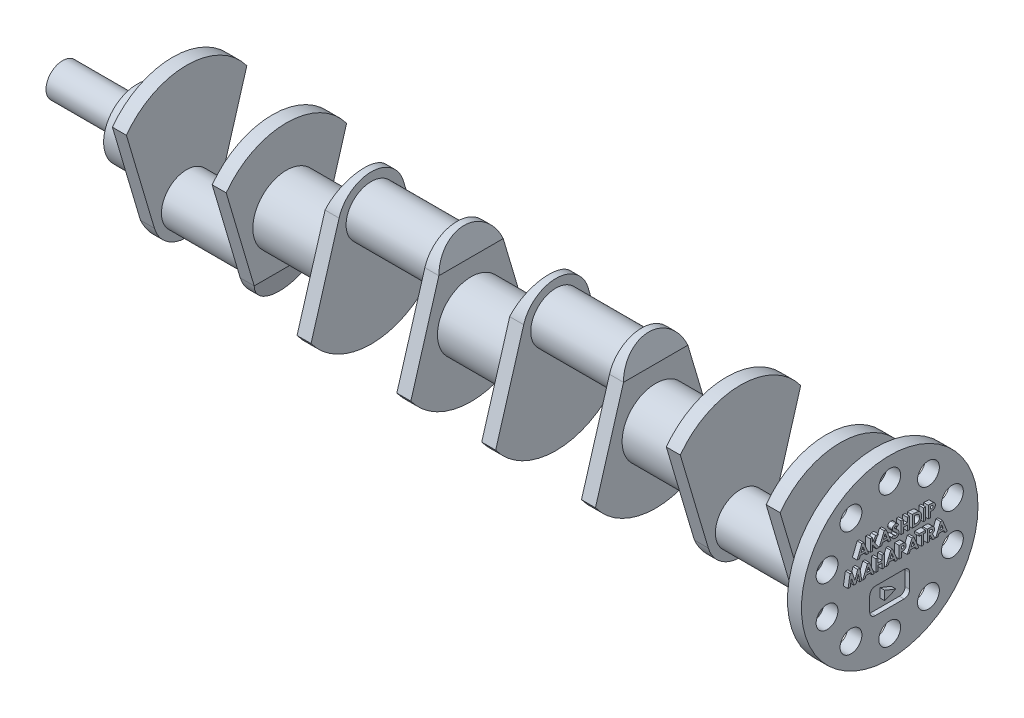
from build123d import *

# Parameters (mm, degrees)
SKETCH1_R               = 36
BOSS_EXTRUDE1_DEPTH     = 38
SKETCH3_R               = 27
BOSS_EXTRUDE2_DEPTH     = 15
SKETCH3_2_R             = 27
BOSS_EXTRUDE3_DEPTH     = 61
CUT_EXTRUDE1_DEPTH      = 143.724458813
CUT_EXTRUDE1_DEPTH_BACK = 143.724458813
BODY_MOVE_COPY1_ANGLE   = 180
SKETCH5_R               = 94.662126669
SKETCH5_R_2             = 11.708716401
BOSS_EXTRUDE4_DEPTH     = 15
SKETCH6_R               = 17.793512753
BOSS_EXTRUDE5_DEPTH     = 80
WRAP1_OUTLINE_W         = 2.279487179
WRAP1_OUTLINE_H         = 12.7
WRAP1_DEPTH             = 5
WRAP2_START             = -5
WRAP2_DEPTH             = 5


# Read off the part's stored shape, not the designer's step: Wrap1, Wrap2
with BuildPart() as part:
    # Sketch1 → Boss-Extrude1 (new body)
    with BuildSketch(Plane(origin=(0, 0, 0), x_dir=(0, 0, -1), z_dir=(1, 0, 0))):
        Circle(SKETCH1_R)
    extrude(amount=BOSS_EXTRUDE1_DEPTH)

    # Sketch3 → Boss-Extrude2 (add)
    with BuildSketch(Plane(origin=(38, 0, 0), x_dir=(0, 0, -1), z_dir=(1, 0, 0))):
        with BuildLine():
            Line((-34.517510455, -54.224552409), (-64.569893475, 47.23059238))
            ThreePointArc((-64.569893475, 47.23059238), (0, 80), (64.569893475, 47.23059238))
            Line((64.569893475, 47.23059238), (34.517510455, -54.224552409))
            ThreePointArc((34.517510455, -54.224552409), (0, -80), (-34.517510455, -54.224552409))
        make_face()
        with Locations(Location((0, -44, 0), (0, 0, 144.817798311))):
            Circle(SKETCH3_R, mode=Mode.SUBTRACT)
    extrude(amount=BOSS_EXTRUDE2_DEPTH)

    # Sketch3<2> → Boss-Extrude3 (add)
    with BuildSketch(Plane(origin=(38, 0, 0), x_dir=(0, 0, -1), z_dir=(1, 0, 0))):
        with Locations(Location((0, -44, 0), (0, 0, 180))):
            Circle(SKETCH3_2_R)
    extrude(amount=BOSS_EXTRUDE3_DEPTH)

    # Sketch4 → Cut-Extrude1 (cut, two sides: drawn at the far end of the back side and taken through both)
    with BuildSketch(Plane.XY.offset(-CUT_EXTRUDE1_DEPTH_BACK)):
        Polygon((38, -54.224552409), (45.5, -80), (38, -80), align=None)
    extrude(amount=CUT_EXTRUDE1_DEPTH + CUT_EXTRUDE1_DEPTH_BACK, mode=Mode.SUBTRACT)

    # Mirror1: part across plane


with BuildPart() as part_1:
    add(part.part)
    add(part.part.mirror(Plane(origin=(99, 0, 0), x_dir=(0, 0, 1), z_dir=(1, 0, 0))))


with BuildPart() as body_2:
    # Mirror2: mirrored copy
    add(part_1.part.mirror(Plane(origin=(198, 0, 0), x_dir=(0, 0, 1), z_dir=(1, 0, 0))))


with BuildPart() as body_2_1:
    # Body-Move/Copy1: moved
    add(body_2.part.rotate(Axis((0, 0, 0), (1, 0, 0)), BODY_MOVE_COPY1_ANGLE))

    # Combine1: union part
    add(part_1.part)

    # Mirror3: body 2 across plane


with BuildPart() as body_2_2:
    add(body_2_1.part)
    add(body_2_1.part.mirror(Plane(origin=(396, 0, 0), x_dir=(0, 0, 1), z_dir=(1, 0, 0))))

    # Sketch5 → Boss-Extrude4 (add)
    with BuildSketch(Plane(origin=(792, 0, 0), x_dir=(0, 0, -1), z_dir=(1, 0, 0))):
        Circle(SKETCH5_R)
        with Locations((0, 70.666718743)):
            Circle(SKETCH5_R_2, mode=Mode.SUBTRACT)
        with Locations((41.536855105, 57.1705764)):
            Circle(SKETCH5_R_2, mode=Mode.SUBTRACT)
        with Locations((67.208043346, 21.837217028)):
            Circle(SKETCH5_R_2, mode=Mode.SUBTRACT)
        with Locations((67.208043346, -21.837217028)):
            Circle(SKETCH5_R_2, mode=Mode.SUBTRACT)
        with Locations((41.536855105, -57.1705764)):
            Circle(SKETCH5_R_2, mode=Mode.SUBTRACT)
        with Locations((0, -70.666718743)):
            Circle(SKETCH5_R_2, mode=Mode.SUBTRACT)
        with Locations((-41.536855105, -57.1705764)):
            Circle(SKETCH5_R_2, mode=Mode.SUBTRACT)
        with Locations((-67.208043346, -21.837217028)):
            Circle(SKETCH5_R_2, mode=Mode.SUBTRACT)
        with Locations((-67.208043346, 21.837217028)):
            Circle(SKETCH5_R_2, mode=Mode.SUBTRACT)
        with Locations((-41.536855105, 57.1705764)):
            Circle(SKETCH5_R_2, mode=Mode.SUBTRACT)
    extrude(amount=BOSS_EXTRUDE4_DEPTH)

    # Sketch6 → Boss-Extrude5 (add)
    with BuildSketch(Plane.ZY):
        Circle(SKETCH6_R)
    extrude(amount=BOSS_EXTRUDE5_DEPTH)

    # Wrap1 outline → Wrap1 (add)
    # profile 1 of 17: a face of its own
    with BuildSketch(Plane(origin=(807, 0, 0), x_dir=(0, 0, -1), z_dir=(1, 0, 0))):
        with BuildLine():
            add(Edge.make_bspline(
                [(2.972212954, 29.383808048), (2.899198316, 29.486802786), (2.759020393, 29.68453832), (2.5318066, 29.94931086), (2.305618794, 30.175181541), (2.078361483, 30.361206779), (1.848020343, 30.506256333), (1.614995214, 30.60895302), (1.38060718, 30.674238278), (1.223134603, 30.682367863), (1.145570326, 30.686372151)],
                knots=[0, 0, 0, 0, 0.162420307, 0.31182434, 0.448432767, 0.573381197, 0.689077147, 0.797572901, 0.900293043, 1, 1, 1, 1], degree=3))
            Line((2.972212954, 29.383808048), (4.676740198, 30.943323272))
            add(Edge.make_bspline(
                [(1.171011031, 32.96585933), (1.320645634, 32.960385378), (1.618733676, 32.949480682), (2.059465444, 32.864209525), (2.489953807, 32.730111649), (2.836849399, 32.568337315), (3.112867746, 32.411626441), (3.324410025, 32.267346808), (3.539665681, 32.102066735), (3.760370616, 31.91526538), (3.982423792, 31.703423159), (4.212139242, 31.471583144), (4.446386812, 31.217741695), (4.598610591, 31.036398541), (4.676740198, 30.943323272)],
                knots=[0, 0, 0, 0, 0.10691022, 0.212976528, 0.319776676, 0.428556273, 0.485856803, 0.546558687, 0.611431498, 0.67982091, 0.753158505, 0.830752869, 0.913133075, 1, 1, 1, 1], degree=3))
            add(Edge.make_bspline(
                [(-2.161721341, 29.745066061), (-2.158966549, 29.853796648), (-2.153539314, 30.068007584), (-2.105127541, 30.382973554), (-2.032774301, 30.68688925), (-1.927696625, 30.97864585), (-1.791318489, 31.257877917), (-1.62569254, 31.525952409), (-1.428246921, 31.780402029), (-1.205739038, 32.021058095), (-0.960592319, 32.240990354), (-0.698621897, 32.435102608), (-0.421310546, 32.599052642), (-0.130354718, 32.735061099), (0.176048521, 32.839166933), (0.49564191, 32.912962337), (0.828883849, 32.95685349), (1.055547823, 32.962819983), (1.171011031, 32.96585933)],
                knots=[0, 0, 0, 0, 0.06317288, 0.12445736, 0.184840915, 0.244566821, 0.304319173, 0.365199786, 0.427420983, 0.491261689, 0.555499002, 0.618604518, 0.680494764, 0.742473305, 0.804990665, 0.868251971, 0.932887217, 1, 1, 1, 1], degree=3))
            add(Edge.make_bspline(
                [(1.038719364, 25.287854522), (0.877069822, 25.424625536), (0.566815423, 25.687130508), (0.128386595, 26.074842089), (-0.266677035, 26.437194087), (-0.614963275, 26.778665964), (-0.920909828, 27.092951528), (-1.182444692, 27.382603525), (-1.396694789, 27.649856224), (-1.622146817, 27.966399161), (-1.836371319, 28.352128481), (-2.021522081, 28.816205569), (-2.141640081, 29.280223772), (-2.155097632, 29.591740036), (-2.161721341, 29.745066061)],
                knots=[0, 0, 0, 0, 0.112124581, 0.215201009, 0.309902452, 0.395959096, 0.473447494, 0.542140328, 0.602523333, 0.654726333, 0.747804055, 0.835278417, 0.918925243, 1, 1, 1, 1], degree=3))
            add(Edge.make_bspline(
                [(2.722894044, 23.097409811), (2.718712332, 23.169878781), (2.710217585, 23.317092555), (2.647647893, 23.535975765), (2.54983238, 23.754759431), (2.434109731, 23.934211713), (2.316347444, 24.084462245), (2.203740137, 24.214647534), (2.066614226, 24.358479487), (1.9053174, 24.516139033), (1.721980813, 24.689014091), (1.516450026, 24.87708773), (1.286371495, 25.078703248), (1.123751536, 25.216041746), (1.038719364, 25.287854522)],
                knots=[0, 0, 0, 0, 0.076346606, 0.155090822, 0.238351561, 0.32840414, 0.37938386, 0.439617644, 0.509831416, 0.588874645, 0.677436354, 0.77554672, 0.882635872, 1, 1, 1, 1], degree=3))
            add(Edge.make_bspline(
                [(1.272773852, 21.894064458), (1.371612549, 21.898061749), (1.563374015, 21.905817076), (1.837088971, 21.97745069), (2.088041206, 22.089920719), (2.304962464, 22.250399941), (2.488637709, 22.435617354), (2.624200583, 22.641680195), (2.709362094, 22.864635214), (2.718365731, 23.019514437), (2.722894044, 23.097409811)],
                knots=[0, 0, 0, 0, 0.141985893, 0.275473311, 0.404345843, 0.535429711, 0.661427401, 0.77786684, 0.888279749, 1, 1, 1, 1], degree=3))
            add(Edge.make_bspline(
                [(-0.808275828, 23.522269586), (-0.734257286, 23.393607651), (-0.592357416, 23.146951724), (-0.351894821, 22.815538224), (-0.105553168, 22.531737421), (0.152362741, 22.300565511), (0.418716745, 22.118931429), (0.694795396, 21.989123113), (0.980792661, 21.908771912), (1.175601005, 21.898959175), (1.272773852, 21.894064458)],
                knots=[0, 0, 0, 0, 0.160457921, 0.307611547, 0.442138888, 0.566229194, 0.681222208, 0.789558005, 0.895028892, 1, 1, 1, 1], degree=3))
            Line((-0.808275828, 23.522269586), (-2.813003392, 22.318924234))
            add(Edge.make_bspline(
                [(1.188819525, 19.614577279), (1.080200932, 19.616504245), (0.865073826, 19.620320743), (0.548008996, 19.651479274), (0.241847059, 19.701765828), (-0.053067118, 19.773841481), (-0.338062178, 19.86517111), (-0.613149824, 19.976726752), (-0.876431035, 20.110237479), (-1.129897921, 20.262957779), (-1.372318321, 20.440286165), (-1.606757545, 20.638597215), (-1.83088692, 20.860941042), (-2.045782894, 21.106791812), (-2.250070503, 21.376845715), (-2.450436813, 21.66734175), (-2.637976943, 21.983671129), (-2.753828823, 22.205578748), (-2.813003392, 22.318924234)],
                knots=[0, 0, 0, 0, 0.063551482, 0.125868382, 0.18624025, 0.244976651, 0.303357688, 0.361230317, 0.418489049, 0.475936712, 0.534203744, 0.594059429, 0.655468694, 0.718771685, 0.784974607, 0.853522316, 0.925182451, 1, 1, 1, 1], degree=3))
            add(Edge.make_bspline(
                [(5.002381223, 23.229701478), (5.000107905, 23.101437205), (4.995647568, 22.84977793), (4.941017003, 22.481512066), (4.863117023, 22.129065652), (4.742669988, 21.796273802), (4.595869855, 21.477673839), (4.411834686, 21.178228539), (4.195710615, 20.894907392), (3.947999246, 20.63277511), (3.674001057, 20.394908233), (3.380111959, 20.183153521), (3.063458156, 20.008323033), (2.726745089, 19.864362597), (2.370152993, 19.753482345), (1.994106675, 19.671531504), (1.598030949, 19.622345901), (1.327188659, 19.61720413), (1.188819525, 19.614577279)],
                knots=[0, 0, 0, 0, 0.065200875, 0.127926544, 0.18904691, 0.248543693, 0.307607127, 0.36724766, 0.426963056, 0.488617128, 0.550391855, 0.611330734, 0.672556085, 0.734024191, 0.797340621, 0.862249627, 0.929625466, 1, 1, 1, 1], degree=3))
            add(Edge.make_bspline(
                [(3.689640839, 26.142662215), (3.801762188, 26.021322902), (4.017298797, 25.78806613), (4.297420407, 25.426591491), (4.527969553, 25.073718538), (4.706326744, 24.722807392), (4.841029268, 24.368795106), (4.935996332, 24.002999546), (4.992872739, 23.621598378), (4.999187348, 23.361338641), (5.002381223, 23.229701478)],
                knots=[0, 0, 0, 0, 0.150833097, 0.289954183, 0.417138648, 0.535255184, 0.648751095, 0.762405462, 0.879826701, 1, 1, 1, 1], degree=3))
            add(Edge.make_bspline(
                [(2.053803499, 27.60804683), (2.160634631, 27.515589874), (2.363377924, 27.340125781), (2.651841369, 27.091082672), (2.905352694, 26.86702466), (3.12760498, 26.671314375), (3.3152291, 26.501898369), (3.469013826, 26.357966835), (3.590837379, 26.242321856), (3.660086935, 26.172472218), (3.689640839, 26.142662215)],
                knots=[0, 0, 0, 0, 0.192952702, 0.366184141, 0.520457298, 0.655012135, 0.770624226, 0.865677185, 0.942674527, 1, 1, 1, 1], degree=3))
            add(Edge.make_bspline(
                [(0.328923691, 29.24642824), (0.358130834, 29.209555599), (0.42536182, 29.124679647), (0.55355754, 28.99024937), (0.714544441, 28.825560513), (0.914517638, 28.636276245), (1.145175693, 28.415589162), (1.417209906, 28.172174558), (1.722789945, 27.898494165), (1.939989157, 27.70791305), (2.053803499, 27.60804683)],
                knots=[0, 0, 0, 0, 0.059234189, 0.136349281, 0.233805212, 0.349411224, 0.48317915, 0.635966856, 0.809243356, 1, 1, 1, 1], degree=3))
            add(Edge.make_bspline(
                [(0.117765839, 29.854461093), (0.120009374, 29.80160011), (0.124527542, 29.695145435), (0.168166897, 29.539122852), (0.233943866, 29.386670625), (0.296796444, 29.293865701), (0.328923691, 29.24642824)],
                knots=[0, 0, 0, 0, 0.241881375, 0.487115475, 0.73783784, 1, 1, 1, 1], degree=3))
            add(Edge.make_bspline(
                [(1.145570326, 30.686372151), (1.073220594, 30.683834851), (0.933532269, 30.678935991), (0.7343962, 30.630241691), (0.557600361, 30.546202481), (0.403317298, 30.436314143), (0.28110235, 30.303924172), (0.183523191, 30.165081133), (0.128577926, 30.011829819), (0.121346047, 29.906570634), (0.117765839, 29.854461093)],
                knots=[0, 0, 0, 0, 0.148126258, 0.285992887, 0.416634394, 0.547379946, 0.671582838, 0.784400739, 0.893265576, 1, 1, 1, 1], degree=3))
        make_face()
    # profile 2 of 17: a face of its own
    with BuildSketch(Plane(origin=(807, 0, 0), x_dir=(0, 0, -1), z_dir=(1, 0, 0))):
        with BuildLine():
            add(Edge.make_bspline(
                [(22.040021448, 32.640218304), (22.263946809, 32.63865299), (22.696797065, 32.635627218), (23.323911453, 32.601534051), (23.907048032, 32.54910118), (24.446582703, 32.476970263), (24.941409334, 32.381521308), (25.390889855, 32.261799302), (25.79653283, 32.123600162), (26.162786052, 31.960980832), (26.497140015, 31.771382842), (26.814619775, 31.560185904), (27.114601966, 31.319653255), (27.401296365, 31.05442525), (27.671003119, 30.759649624), (27.928213812, 30.44020893), (28.166630759, 30.091470836), (28.393460789, 29.721796983), (28.598598368, 29.329620727), (28.777527029, 28.918280192), (28.927416654, 28.490422507), (29.049209736, 28.045591687), (29.146292878, 27.585264435), (29.214219996, 27.108511854), (29.256213218, 26.615775336), (29.260473079, 26.281823605), (29.262637634, 26.112133369)],
                knots=[0, 0, 0, 0, 0.060148162, 0.116267077, 0.168653955, 0.217398969, 0.262433523, 0.303932701, 0.342259967, 0.377441339, 0.411406099, 0.445398351, 0.479766387, 0.514584482, 0.550213651, 0.587000908, 0.624662987, 0.663615456, 0.703456428, 0.743450162, 0.784013386, 0.825132536, 0.867264663, 0.910306473, 0.954424205, 1, 1, 1, 1], degree=3))
            Line((22.040021448, 32.640218304), (19.167765839, 32.640218304))
            Line((19.167765839, 32.640218304), (19.167765839, 19.940218304))
            Line((19.167765839, 19.940218304), (22.083270647, 19.940218304))
            add(Edge.make_bspline(
                [(29.262637634, 26.112133369), (29.25696966, 25.872689399), (29.245811923, 25.401329929), (29.151825379, 24.709615338), (28.999817313, 24.046537912), (28.786080166, 23.417284499), (28.52110332, 22.827458695), (28.204558805, 22.287461829), (27.841087902, 21.800192332), (27.434925067, 21.368076407), (26.995149638, 20.996666912), (26.538134286, 20.678581859), (26.059426848, 20.427745253), (25.637618695, 20.268677335), (25.271858402, 20.169750852), (24.950724822, 20.111284348), (24.585949841, 20.057667037), (24.174132251, 20.016232733), (23.717078604, 19.979283516), (23.212967079, 19.95920675), (22.663429846, 19.942525937), (22.281724279, 19.941007671), (22.083270647, 19.940218304)],
                knots=[0, 0, 0, 0, 0.065772947, 0.129477895, 0.191430088, 0.252445668, 0.311786958, 0.36881755, 0.424091518, 0.478492106, 0.531393744, 0.58200397, 0.631201271, 0.679503008, 0.705561374, 0.735221723, 0.769132486, 0.80685832, 0.848929771, 0.895116661, 0.945469804, 1, 1, 1, 1], degree=3))
        make_face()
        with BuildLine():
            add(Edge.make_bspline(
                [(22.637878018, 22.219705484), (22.779544108, 22.219965075), (23.05201516, 22.220464355), (23.445401682, 22.244245481), (23.809184468, 22.268115174), (24.142362111, 22.31342065), (24.447359372, 22.363887762), (24.719986389, 22.434119658), (24.965863188, 22.507892316), (25.181986433, 22.601814053), (25.379937716, 22.707529219), (25.563217993, 22.831386791), (25.740134775, 22.968925954), (25.90738046, 23.12419193), (26.065588032, 23.295128705), (26.213821436, 23.482617042), (26.354059195, 23.686084908), (26.482701671, 23.906608087), (26.600255855, 24.141857806), (26.704539588, 24.389555327), (26.791006191, 24.651763438), (26.862871938, 24.926027555), (26.914228163, 25.214735459), (26.956715644, 25.51574873), (26.978619178, 25.830259957), (26.981625302, 26.044263908), (26.983150454, 26.152838497)],
                knots=[0, 0, 0, 0, 0.062614648, 0.120428813, 0.174199486, 0.223724664, 0.26902845, 0.310765001, 0.348115258, 0.382378114, 0.414753161, 0.447195432, 0.480044579, 0.513738641, 0.547962504, 0.582917814, 0.619315101, 0.657123545, 0.695686576, 0.735513716, 0.7758232, 0.817652262, 0.860742584, 0.905386927, 0.951998197, 1, 1, 1, 1], degree=3))
            Line((22.637878018, 22.219705484), (21.447253018, 22.219705484))
            Line((21.447253018, 22.219705484), (21.447253018, 30.360731125))
            Line((21.447253018, 30.360731125), (22.317325134, 30.360731125))
            add(Edge.make_bspline(
                [(25.784893243, 29.34310292), (25.690433567, 29.425777998), (25.497510374, 29.594632484), (25.158800647, 29.796963339), (24.785560069, 29.974730828), (24.369250015, 30.115680621), (23.913893938, 30.227149727), (23.416779727, 30.304027243), (22.880569537, 30.35342792), (22.509095611, 30.358244568), (22.317325134, 30.360731125)],
                knots=[0, 0, 0, 0, 0.101663476, 0.207636138, 0.318744567, 0.436679942, 0.563506646, 0.698681208, 0.844446556, 1, 1, 1, 1], degree=3))
            add(Edge.make_bspline(
                [(26.983150454, 26.152838497), (26.980112869, 26.31921879), (26.974189812, 26.643647471), (26.917069134, 27.116184925), (26.824087567, 27.561149728), (26.691411829, 27.976890495), (26.524169949, 28.364575677), (26.314827752, 28.720920758), (26.072394519, 29.051911845), (25.880684932, 29.246081838), (25.784893243, 29.34310292)],
                knots=[0, 0, 0, 0, 0.142276686, 0.277428514, 0.406477152, 0.530595072, 0.650142922, 0.766850697, 0.883502093, 1, 1, 1, 1], degree=3))
        make_face(mode=Mode.SUBTRACT)
    # profile 3 of 17: a face of its own
    with BuildSketch(Plane(origin=(807, 0, 0), x_dir=(0, 0, -1), z_dir=(1, 0, 0))):
        with BuildLine():
            add(Edge.make_bspline(
                [(38.970810711, 32.640218304), (39.137036978, 32.63947424), (39.45772229, 32.638038785), (39.920176894, 32.620631975), (40.346813909, 32.589437911), (40.737535316, 32.550886981), (41.09218046, 32.496840078), (41.411193464, 32.434879535), (41.694640529, 32.359393561), (41.945717944, 32.269792755), (42.171051813, 32.164156906), (42.384290331, 32.051647186), (42.580614282, 31.917370804), (42.76993273, 31.775799497), (42.941422013, 31.613409014), (43.105780658, 31.441006676), (43.256047629, 31.251755148), (43.392919207, 31.04794527), (43.517082819, 30.833342576), (43.625560457, 30.60756342), (43.713551442, 30.370250531), (43.787364937, 30.122939053), (43.846652655, 29.865639764), (43.886116448, 29.596770251), (43.912922241, 29.318207863), (43.915287482, 29.128618126), (43.916483788, 29.032726317)],
                knots=[0, 0, 0, 0, 0.070781161, 0.136551696, 0.197012482, 0.252922694, 0.303686532, 0.349719151, 0.391240471, 0.428478555, 0.463056565, 0.497150358, 0.531002334, 0.564226377, 0.59770067, 0.631421421, 0.665597347, 0.700451436, 0.735880684, 0.771092108, 0.806974845, 0.843534403, 0.880940196, 0.919294384, 0.95918024, 1, 1, 1, 1], degree=3))
            Line((38.970810711, 32.640218304), (36.426740198, 32.640218304))
            Line((36.426740198, 32.640218304), (36.426740198, 19.940218304))
            Line((36.426740198, 19.940218304), (38.706227377, 19.940218304))
            Line((38.706227377, 19.940218304), (38.706227377, 25.47611574))
            add(Edge.make_bspline(
                [(41.293547089, 25.669465099), (41.228442459, 25.653266962), (41.087404865, 25.61817658), (40.854026385, 25.582551036), (40.585082191, 25.549795538), (40.279702609, 25.521646153), (39.937711582, 25.50251113), (39.559440246, 25.487567528), (39.144717174, 25.476701987), (38.85633515, 25.476316429), (38.706227377, 25.47611574)],
                knots=[0, 0, 0, 0, 0.077372749, 0.167614291, 0.272108317, 0.390015992, 0.52136331, 0.667272254, 0.826809521, 1, 1, 1, 1], degree=3))
            add(Edge.make_bspline(
                [(43.916483788, 29.032726317), (43.914752883, 28.926643492), (43.911351444, 28.718177704), (43.878006373, 28.412592436), (43.821042458, 28.121244549), (43.7465936, 27.841677056), (43.642779962, 27.578489461), (43.524177756, 27.325402028), (43.378259423, 27.089510551), (43.2115244, 26.867864312), (43.029430733, 26.658661223), (42.827655527, 26.467941627), (42.610044702, 26.294405395), (42.377857932, 26.136233854), (42.130223516, 25.993746072), (41.867320135, 25.865607801), (41.587352535, 25.7559173), (41.392391523, 25.698550057), (41.293547089, 25.669465099)],
                knots=[0, 0, 0, 0, 0.068875425, 0.135348675, 0.199289315, 0.26155008, 0.322915384, 0.382771997, 0.442843572, 0.502652029, 0.562748843, 0.622739582, 0.682687332, 0.743329247, 0.805012514, 0.86806712, 0.933110571, 1, 1, 1, 1], degree=3))
        make_face()
        with BuildLine():
            add(Edge.make_bspline(
                [(39.51269773, 27.75560292), (39.659447743, 27.756533429), (39.929469947, 27.758245579), (40.298224924, 27.783004269), (40.594563517, 27.820815788), (40.828676508, 27.875046252), (41.013530889, 27.957348162), (41.17295622, 28.052555973), (41.309699396, 28.172943636), (41.428098859, 28.310507141), (41.522755663, 28.468574502), (41.588395225, 28.644571901), (41.631033395, 28.834801442), (41.634971426, 28.967188612), (41.636996608, 29.035270388)],
                knots=[0, 0, 0, 0, 0.155159592, 0.285495954, 0.390502806, 0.470975045, 0.538445527, 0.60365534, 0.666587169, 0.73019895, 0.794944675, 0.860228437, 0.928120706, 1, 1, 1, 1], degree=3))
            Line((39.51269773, 27.75560292), (38.706227377, 27.75560292))
            Line((38.706227377, 27.75560292), (38.706227377, 30.360731125))
            Line((38.706227377, 30.360731125), (39.423655262, 30.360731125))
            add(Edge.make_bspline(
                [(41.039140038, 30.108868144), (40.99882373, 30.129257257), (40.913465844, 30.172425187), (40.76809309, 30.222611063), (40.600335152, 30.264948377), (40.409059474, 30.300087939), (40.19502911, 30.327359888), (39.958282247, 30.348216107), (39.69847049, 30.356603205), (39.517786958, 30.3593172), (39.423655262, 30.360731125)],
                knots=[0, 0, 0, 0, 0.08210116, 0.173824981, 0.278953094, 0.396639095, 0.527315592, 0.671298143, 0.82875438, 1, 1, 1, 1], degree=3))
            add(Edge.make_bspline(
                [(41.636996608, 29.035270388), (41.634992258, 29.094752549), (41.631103336, 29.210162243), (41.602534257, 29.376727058), (41.557003365, 29.531999826), (41.491030851, 29.674358929), (41.405744013, 29.803562476), (41.301762098, 29.919559569), (41.180419399, 30.024834384), (41.08673574, 30.080557952), (41.039140038, 30.108868144)],
                knots=[0, 0, 0, 0, 0.137787685, 0.267341238, 0.390444331, 0.511777883, 0.629508981, 0.747829066, 0.87188531, 1, 1, 1, 1], degree=3))
        make_face(mode=Mode.SUBTRACT)
    # profile 4 of 17: a face of its own
    with BuildSketch(Plane(origin=(807, 0, 0), x_dir=(0, 0, -1), z_dir=(1, 0, 0))):
        with BuildLine():
            add(Edge.make_bspline(
                [(7.709272249, 10.962013176), (7.875498516, 10.961269112), (8.196183828, 10.959833656), (8.658638432, 10.942426846), (9.085275447, 10.911232783), (9.475996854, 10.872681853), (9.830641999, 10.81863495), (10.149655002, 10.756674407), (10.433102068, 10.681188432), (10.684179482, 10.591587627), (10.909513352, 10.485951778), (11.122751869, 10.373442058), (11.31907582, 10.239165676), (11.508394268, 10.097594369), (11.679883551, 9.935203886), (11.844242196, 9.762801548), (11.994509168, 9.57355002), (12.131380746, 9.369740141), (12.255544358, 9.155137447), (12.364021995, 8.929358292), (12.45201298, 8.692045402), (12.525826475, 8.444733924), (12.585114193, 8.187434636), (12.624577986, 7.918565123), (12.651383779, 7.640002735), (12.65374902, 7.450412998), (12.654945326, 7.354521189)],
                knots=[0, 0, 0, 0, 0.070781161, 0.136551696, 0.197012482, 0.252922694, 0.303686532, 0.349719151, 0.391240471, 0.428478555, 0.463056565, 0.497150358, 0.531002334, 0.564226377, 0.59770067, 0.631421421, 0.665597347, 0.700451436, 0.735880684, 0.771092108, 0.806974845, 0.843534403, 0.880940196, 0.919294384, 0.95918024, 1, 1, 1, 1], degree=3))
            Line((7.709272249, 10.962013176), (5.165201736, 10.962013176))
            Line((5.165201736, 10.962013176), (5.165201736, -1.737986824))
            Line((5.165201736, -1.737986824), (7.444688916, -1.737986824))
            Line((7.444688916, -1.737986824), (7.444688916, 3.797910612))
            add(Edge.make_bspline(
                [(10.032008627, 3.991259971), (9.966903997, 3.975061834), (9.825866403, 3.939971452), (9.592487924, 3.904345907), (9.323543729, 3.871590409), (9.018164148, 3.843441024), (8.676173121, 3.824306002), (8.297901784, 3.8093624), (7.883178713, 3.798496858), (7.594796689, 3.798111301), (7.444688916, 3.797910612)],
                knots=[0, 0, 0, 0, 0.077372749, 0.167614291, 0.272108317, 0.390015992, 0.52136331, 0.667272254, 0.826809521, 1, 1, 1, 1], degree=3))
            add(Edge.make_bspline(
                [(12.654945326, 7.354521189), (12.653214422, 7.248438364), (12.649812982, 7.039972576), (12.616467912, 6.734387307), (12.559503996, 6.443039421), (12.485055138, 6.163471928), (12.381241501, 5.900284333), (12.262639294, 5.6471969), (12.116720961, 5.411305423), (11.949985939, 5.189659184), (11.767892272, 4.980456095), (11.566117065, 4.789736499), (11.348506241, 4.616200267), (11.11631947, 4.458028726), (10.868685054, 4.315540944), (10.605781673, 4.187402672), (10.325814074, 4.077712172), (10.130853061, 4.020344928), (10.032008627, 3.991259971)],
                knots=[0, 0, 0, 0, 0.068875425, 0.135348675, 0.199289315, 0.26155008, 0.322915384, 0.382771997, 0.442843572, 0.502652029, 0.562748843, 0.622739582, 0.682687332, 0.743329247, 0.805012514, 0.86806712, 0.933110571, 1, 1, 1, 1], degree=3))
        make_face()
        with BuildLine():
            add(Edge.make_bspline(
                [(8.251159268, 6.077397792), (8.397909281, 6.078328301), (8.667931485, 6.080040451), (9.036686462, 6.10479914), (9.333025055, 6.14261066), (9.567138047, 6.196841124), (9.751992428, 6.279143033), (9.911417758, 6.374350844), (10.048160934, 6.494738508), (10.166560398, 6.632302013), (10.261217201, 6.790369374), (10.326856764, 6.966366772), (10.369494933, 7.156596314), (10.373432964, 7.288983483), (10.375458147, 7.35706526)],
                knots=[0, 0, 0, 0, 0.155159592, 0.285495954, 0.390502806, 0.470975045, 0.538445527, 0.60365534, 0.666587169, 0.73019895, 0.794944675, 0.860228437, 0.928120706, 1, 1, 1, 1], degree=3))
            Line((8.251159268, 6.077397792), (7.444688916, 6.077397792))
            Line((7.444688916, 6.077397792), (7.444688916, 8.682525997))
            Line((7.444688916, 8.682525997), (8.1621168, 8.682525997))
            add(Edge.make_bspline(
                [(9.777601576, 8.430663016), (9.737285268, 8.451052129), (9.651927383, 8.494220059), (9.506554629, 8.544405934), (9.33879669, 8.586743249), (9.147521012, 8.621882811), (8.933490649, 8.64915476), (8.696743786, 8.670010979), (8.436932028, 8.678398077), (8.256248497, 8.681112072), (8.1621168, 8.682525997)],
                knots=[0, 0, 0, 0, 0.08210116, 0.173824981, 0.278953094, 0.396639095, 0.527315592, 0.671298143, 0.82875438, 1, 1, 1, 1], degree=3))
            add(Edge.make_bspline(
                [(10.375458147, 7.35706526), (10.373453796, 7.416547421), (10.369564874, 7.531957115), (10.340995796, 7.698521929), (10.295464903, 7.853794698), (10.22949239, 7.9961538), (10.144205552, 8.125357347), (10.040223637, 8.241354441), (9.918880937, 8.346629256), (9.825197279, 8.402352824), (9.777601576, 8.430663016)],
                knots=[0, 0, 0, 0, 0.137787685, 0.267341238, 0.390444331, 0.511777883, 0.629508981, 0.747829066, 0.87188531, 1, 1, 1, 1], degree=3))
        make_face(mode=Mode.SUBTRACT)
    # profile 5 of 17: a face of its own
    with BuildSketch(Plane(origin=(807, 0, 0), x_dir=(0, 0, -1), z_dir=(1, 0, 0))):
        with BuildLine():
            add(Edge.make_bspline(
                [(37.943006223, 10.962013176), (38.118567651, 10.961390034), (38.456221728, 10.960191556), (38.943100465, 10.941282745), (39.390365542, 10.914969582), (39.798679175, 10.874814997), (40.167866681, 10.821574871), (40.498298071, 10.758813573), (40.789963689, 10.687283618), (41.045323329, 10.598151651), (41.275772778, 10.497612143), (41.490583703, 10.382090405), (41.694495152, 10.252872808), (41.886144198, 10.106559287), (42.067196316, 9.945781986), (42.237993071, 9.770379067), (42.396120948, 9.578863186), (42.540600812, 9.37244448), (42.672282578, 9.155296735), (42.788661641, 8.927121805), (42.883301288, 8.687761011), (42.966925562, 8.440673632), (43.027157417, 8.182327507), (43.069047791, 7.915237678), (43.099718284, 7.638463961), (43.101481691, 7.450436187), (43.102381223, 7.354521189)],
                knots=[0, 0, 0, 0, 0.072889027, 0.14018613, 0.202277434, 0.258895132, 0.310482942, 0.357095244, 0.398513567, 0.435037511, 0.469251486, 0.502805028, 0.536210446, 0.56937936, 0.602801475, 0.636665798, 0.670928657, 0.705803, 0.741189061, 0.776304311, 0.812004301, 0.847968976, 0.884521761, 0.921974159, 0.960198176, 1, 1, 1, 1], degree=3))
            Line((37.943006223, 10.962013176), (35.286996608, 10.962013176))
            Line((35.286996608, 10.962013176), (35.286996608, -1.737986824))
            Line((35.286996608, -1.737986824), (37.566483788, -1.737986824))
            Line((37.566483788, -1.737986824), (37.566483788, 3.797910612))
            Line((37.566483788, 3.797910612), (38.339881223, 3.797910612))
            Line((38.339881223, 3.797910612), (41.138358788, -1.737986824))
            Line((41.138358788, -1.737986824), (43.672253018, -1.737986824))
            Line((43.672253018, -1.737986824), (40.741483788, 4.057405804))
            add(Edge.make_bspline(
                [(43.102381223, 7.354521189), (43.100044561, 7.254407965), (43.095462791, 7.058104179), (43.070782886, 6.769749928), (43.025675773, 6.493872751), (42.957354488, 6.23128038), (42.878828045, 5.97870455), (42.774408019, 5.74080544), (42.6565597, 5.514123155), (42.516594694, 5.301864199), (42.362989937, 5.099313879), (42.184350837, 4.914232647), (41.992250461, 4.73667309), (41.77589015, 4.577756934), (41.544807267, 4.426738844), (41.294410437, 4.289876237), (41.026333836, 4.163728702), (40.837862709, 4.093380122), (40.741483788, 4.057405804)],
                knots=[0, 0, 0, 0, 0.068741263, 0.134789088, 0.19853605, 0.260385651, 0.320961578, 0.37990385, 0.438502936, 0.496154344, 0.554265483, 0.612748761, 0.672513443, 0.733646402, 0.796789619, 0.861935699, 0.929397735, 1, 1, 1, 1], degree=3))
        make_face()
        with BuildLine():
            add(Edge.make_bspline(
                [(38.454364397, 6.077397792), (38.562915181, 6.078620364), (38.77076661, 6.080961326), (39.069684264, 6.09181968), (39.341172781, 6.117982949), (39.586398026, 6.151039261), (39.80659395, 6.189207547), (39.999796481, 6.243905018), (40.168982577, 6.302514743), (40.312147377, 6.375351427), (40.434464092, 6.458182535), (40.540076746, 6.552280733), (40.627433554, 6.661187415), (40.699332663, 6.781942968), (40.755262353, 6.915615444), (40.796086742, 7.060737423), (40.818901538, 7.218962031), (40.821526458, 7.328158555), (40.822894044, 7.385050035)],
                knots=[0, 0, 0, 0, 0.105539996, 0.202086415, 0.290684899, 0.37055261, 0.442670262, 0.507674928, 0.565573203, 0.616454666, 0.663331357, 0.708862024, 0.7534118, 0.798515011, 0.845064321, 0.893873119, 0.944707806, 1, 1, 1, 1], degree=3))
            Line((38.454364397, 6.077397792), (37.566483788, 6.077397792))
            Line((37.566483788, 6.077397792), (37.566483788, 8.682525997))
            Line((37.566483788, 8.682525997), (38.342425294, 8.682525997))
            add(Edge.make_bspline(
                [(40.822894044, 7.385050035), (40.820308498, 7.45235681), (40.815229673, 7.584568496), (40.764831945, 7.774906965), (40.68460965, 7.951078241), (40.574646855, 8.112286338), (40.436163011, 8.253612484), (40.277241873, 8.378192608), (40.094453541, 8.476701248), (39.925205301, 8.541676498), (39.771228962, 8.58055186), (39.632270175, 8.609521437), (39.471355062, 8.630053007), (39.288362142, 8.651830392), (39.083757871, 8.665951924), (38.856427031, 8.676257827), (38.607022517, 8.680474478), (38.433163882, 8.681822468), (38.342425294, 8.682525997)],
                knots=[0, 0, 0, 0, 0.06376896, 0.125262305, 0.185413583, 0.246806762, 0.309422389, 0.372532682, 0.437733251, 0.505749517, 0.544013263, 0.588369599, 0.640389019, 0.697897401, 0.763271619, 0.834978604, 0.913873656, 1, 1, 1, 1], degree=3))
        make_face(mode=Mode.SUBTRACT)
    # profile 6 of 17: a face of its own
    with BuildSketch(Plane(origin=(807, 0, 0), x_dir=(0, 0, -1), z_dir=(1, 0, 0))):
        Polygon((-27.643131597, 19.940218304), (-32.771977751, 32.640218304), (-34.886100347, 32.640218304), (-40.017490571, 19.940218304), (-37.585359161, 19.940218304), (-36.598259802, 22.54534651), (-31.064906437, 22.54534651), (-30.077807078, 19.940218304), align=None)
        Polygon((-31.927346341, 24.824833689), (-35.733275828, 24.824833689), (-33.830311084, 29.233707888), align=None, mode=Mode.SUBTRACT)
    # profile 7 of 17: a face of its own
    with BuildSketch(Plane(origin=(807, 0, 0), x_dir=(0, 0, -1), z_dir=(1, 0, 0))):
        Polygon((-19.316388809, 19.940218304), (-16.571336725, 19.940218304), (-21.537362366, 27.022910612), (-17.011460924, 32.640218304), (-19.888804674, 32.640218304), (-23.49120852, 28.170286413), (-23.49120852, 32.640218304), (-25.7706957, 32.640218304), (-25.7706957, 19.940218304), (-23.49120852, 19.940218304), (-23.49120852, 25.895887375), align=None)
    # profile 8 of 17: a face of its own
    with BuildSketch(Plane(origin=(807, 0, 0), x_dir=(0, 0, -1), z_dir=(1, 0, 0))):
        Polygon((-6.143191693, 19.940218304), (-3.708516212, 19.940218304), (-8.837362366, 32.640218304), (-10.951484962, 32.640218304), (-16.082875187, 19.940218304), (-13.650743777, 19.940218304), (-12.663644418, 22.54534651), (-7.130291052, 22.54534651), align=None)
        Polygon((-7.992730956, 24.824833689), (-11.798660443, 24.824833689), (-9.8956957, 29.233707888), align=None, mode=Mode.SUBTRACT)
    # profile 9 of 17: a face of its own
    with BuildSketch(Plane(origin=(807, 0, 0), x_dir=(0, 0, -1), z_dir=(1, 0, 0))):
        Polygon((13.957509429, 19.940218304), (16.236996608, 19.940218304), (16.236996608, 32.640218304), (13.957509429, 32.640218304), (13.957509429, 27.75560292), (9.561355582, 27.75560292), (9.561355582, 32.640218304), (7.281868403, 32.640218304), (7.281868403, 19.940218304), (9.561355582, 19.940218304), (9.561355582, 25.47611574), (13.957509429, 25.47611574), align=None)
    # profile 10 of 17: a face of its own
    with BuildSketch(Plane(origin=(807, 0, 0), x_dir=(0, 0, -1), z_dir=(1, 0, 0))):
        with Locations((32.356227378, 26.290218304)):
            Rectangle(WRAP1_OUTLINE_W, WRAP1_OUTLINE_H)
    # profile 11 of 17: a face of its own
    with BuildSketch(Plane(origin=(807, 0, 0), x_dir=(0, 0, -1), z_dir=(1, 0, 0))):
        Polygon((33.495970967, 8.682525997), (33.495970967, 10.962013176), (26.657509429, 10.962013176), (26.657509429, 8.682525997), (28.936996608, 8.682525997), (28.936996608, -1.737986824), (31.216483788, -1.737986824), (31.216483788, 8.682525997), align=None)
    # profile 12 of 17: a face of its own
    with BuildSketch(Plane(origin=(807, 0, 0), x_dir=(0, 0, -1), z_dir=(1, 0, 0))):
        Polygon((-42.296977751, 2.103559651), (-45.194674065, 10.962013176), (-47.560659642, 10.962013176), (-49.705311084, -1.737986824), (-47.395295059, -1.737986824), (-46.041849546, 6.283467503), (-43.416368777, -1.737986824), (-41.192851148, -1.737986824), (-38.552105956, 6.283467503), (-37.196116373, -1.737986824), (-34.888644418, -1.737986824), (-37.03583993, 10.962013176), (-39.378928873, 10.962013176), align=None)
    # profile 13 of 17: a face of its own
    with BuildSketch(Plane(origin=(807, 0, 0), x_dir=(0, 0, -1), z_dir=(1, 0, 0))):
        Polygon((-26.747618777, 10.962013176), (-28.861741373, 10.962013176), (-33.993131597, -1.737986824), (-31.561000187, -1.737986824), (-30.573900828, 0.867141381), (-25.040547462, 0.867141381), (-24.053448103, -1.737986824), (-21.618772623, -1.737986824), align=None)
        Polygon((-25.902987366, 3.146628561), (-29.708916853, 3.146628561), (-27.80595211, 7.55550276), align=None, mode=Mode.SUBTRACT)
    # profile 14 of 17: a face of its own
    with BuildSketch(Plane(origin=(807, 0, 0), x_dir=(0, 0, -1), z_dir=(1, 0, 0))):
        Polygon((-10.79120852, 10.962013176), (-13.0706957, 10.962013176), (-13.0706957, 6.077397792), (-17.466849546, 6.077397792), (-17.466849546, 10.962013176), (-19.746336725, 10.962013176), (-19.746336725, -1.737986824), (-17.466849546, -1.737986824), (-17.466849546, 3.797910612), (-13.0706957, 3.797910612), (-13.0706957, -1.737986824), (-10.79120852, -1.737986824), align=None)
    # profile 15 of 17: a face of its own
    with BuildSketch(Plane(origin=(807, 0, 0), x_dir=(0, 0, -1), z_dir=(1, 0, 0))):
        Polygon((-1.836080315, 10.962013176), (-3.950202911, 10.962013176), (-9.081593136, -1.737986824), (-6.649461725, -1.737986824), (-5.662362366, 0.867141381), (-0.129009001, 0.867141381), (0.858090358, -1.737986824), (3.292765839, -1.737986824), align=None)
        Polygon((-0.991448905, 3.146628561), (-4.797378392, 3.146628561), (-2.894413648, 7.55550276), align=None, mode=Mode.SUBTRACT)
    # profile 16 of 17: a face of its own
    with BuildSketch(Plane(origin=(807, 0, 0), x_dir=(0, 0, -1), z_dir=(1, 0, 0))):
        Polygon((20.95879148, 10.962013176), (18.844668884, 10.962013176), (13.713278659, -1.737986824), (16.14541007, -1.737986824), (17.132509429, 0.867141381), (22.665862794, 0.867141381), (23.652962153, -1.737986824), (26.087637634, -1.737986824), align=None)
        Polygon((21.80342289, 3.146628561), (17.997493403, 3.146628561), (19.900458147, 7.55550276), align=None, mode=Mode.SUBTRACT)
    # profile 17 of 17: a face of its own
    with BuildSketch(Plane(origin=(807, 0, 0), x_dir=(0, 0, -1), z_dir=(1, 0, 0))):
        Polygon((51.56904789, 10.962013176), (49.454925294, 10.962013176), (44.32353507, -1.737986824), (46.75566648, -1.737986824), (47.742765839, 0.867141381), (53.276119204, 0.867141381), (54.263218563, -1.737986824), (56.697894044, -1.737986824), align=None)
        Polygon((52.4136793, 3.146628561), (48.607749813, 3.146628561), (50.510714557, 7.55550276), align=None, mode=Mode.SUBTRACT)
    extrude(amount=WRAP1_DEPTH)

    # Wrap2 outline → Wrap2 (cut)
    with BuildSketch(Plane(origin=(807, 0, 0), x_dir=(0, 0, -1), z_dir=(1, 0, 0)).offset(WRAP2_START)):
        with BuildLine():
            Line((-15.429839426, -46.396758526), (15.429839426, -46.396758526))
            ThreePointArc((15.429839426, -46.396758526), (19.672480113, -44.639399213), (21.429839426, -40.396758526))
            Line((21.429839426, -40.396758526), (21.429839426, -24.982502654))
            ThreePointArc((21.429839426, -24.982502654), (19.672480113, -20.739861967), (15.429839426, -18.982502654))
            Line((15.429839426, -18.982502654), (-15.429839426, -18.982502654))
            ThreePointArc((-15.429839426, -18.982502654), (-19.672480113, -20.739861967), (-21.429839426, -24.982502654))
            Line((-21.429839426, -24.982502654), (-21.429839426, -40.396758526))
            ThreePointArc((-21.429839426, -40.396758526), (-19.672480113, -44.639399213), (-15.429839426, -46.396758526))
        make_face()
        Polygon((6.579789785, -32.68963059), (-5.346621598, -37.670160484), (-5.346621598, -28.000240043), align=None, mode=Mode.SUBTRACT)
    extrude(amount=WRAP2_DEPTH, mode=Mode.SUBTRACT)


solid = body_2_2.part
